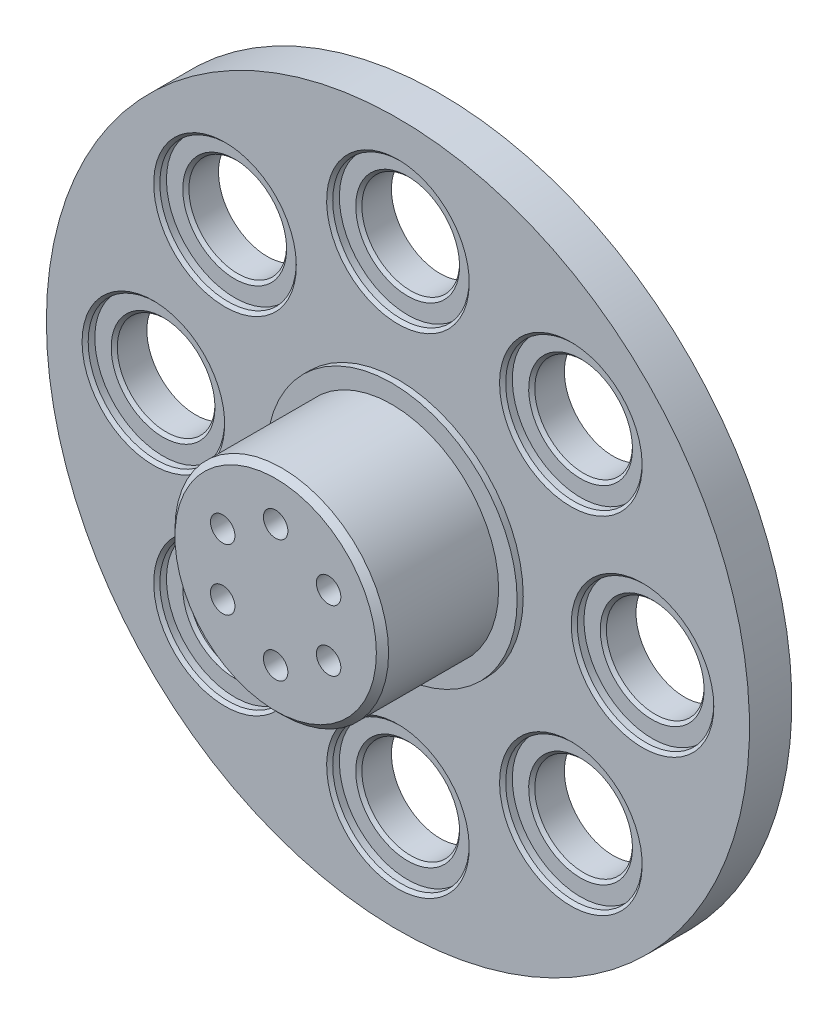
from build123d import *

# Parameters (mm, degrees)
SKETCH1_R                    = 17.475
BOSS_EXTRUDE1_DEPTH          = 19
SKETCH7_R                    = 20.5
BOSS_EXTRUDE3_DEPTH          = 1
SKETCH3_R                    = 57.5
BOSS_EXTRUDE2_DEPTH          = 6.925
SKETCH4_R                    = 11.0375
CUT_EXTRUDE1_DEPTH           = 7
SKETCH5_R                    = 7.5
CUT_EXTRUDE2_DEPTH           = 0.5
SKETCH6_R                    = 2
CUT_EXTRUDE3_DEPTH           = 10
CIRPATTERN1_COUNT            = 6
CHAMFER1_SIZE                = 1
SKETCH8_R                    = 7.99
CUT_EXTRUDE4_DEPTH           = 84.740671122
SKETCH9_R                    = 11.1625
CUT_EXTRUDE5_DEPTH           = 1.5875
CHAMFER2_SIZE                = 0.5
CHAMFER3_SIZE                = 0.5
CIRPATTERN2_COUNT            = 8
CHAMFER2_OF_CIRPATTERN2_SIZE = 0.5
CHAMFER3_OF_CIRPATTERN2_SIZE = 0.5


with BuildPart() as part:
    # Sketch1 → Boss-Extrude1 (new body)
    with BuildSketch(Plane.XY):
        Circle(SKETCH1_R)
    extrude(amount=BOSS_EXTRUDE1_DEPTH)

    # Sketch7 → Boss-Extrude3 (add)
    with BuildSketch(Plane(origin=(0, 0, 0), x_dir=(-1, 0, 0), z_dir=(0, 0, -1))):
        Circle(SKETCH7_R)
    extrude(amount=BOSS_EXTRUDE3_DEPTH)

    # Sketch3 → Boss-Extrude2 (add)
    with BuildSketch(Plane(origin=(0, 0, -1), x_dir=(-1, 0, 0), z_dir=(0, 0, -1))):
        Circle(SKETCH3_R)
    extrude(amount=BOSS_EXTRUDE2_DEPTH)

    # Sketch4 → Cut-Extrude1 (cut)
    with BuildSketch(Plane(origin=(0, 0, -7.925), x_dir=(-1, 0, 0), z_dir=(0, 0, -1))):
        Circle(SKETCH4_R)
    extrude(amount=-CUT_EXTRUDE1_DEPTH, mode=Mode.SUBTRACT)

    # Sketch5 → Cut-Extrude2 (cut)
    with BuildSketch(Plane(origin=(0, 0, -0.925), x_dir=(-1, 0, 0), z_dir=(0, 0, -1))):
        Circle(SKETCH5_R)
    extrude(amount=-CUT_EXTRUDE2_DEPTH, mode=Mode.SUBTRACT)

    # Sketch6 → Cut-Extrude3 (cut)
    with BuildSketch(Plane.XY.offset(19)):
        with Locations((0, 10)):
            Circle(SKETCH6_R)
    cut_extrude3 = extrude(amount=-CUT_EXTRUDE3_DEPTH, mode=Mode.SUBTRACT)

    # CirPattern1: Cut-Extrude3 ×6 about axis
    cirpattern1_axis = Axis((0, 0, 19), (0, 0, 1))
    for i in range(1, CIRPATTERN1_COUNT):
        add(cut_extrude3.rotate(cirpattern1_axis, i * 360 / CIRPATTERN1_COUNT), mode=Mode.SUBTRACT)

    # Chamfer1
    chamfer1_edges = [part.edges().sort_by_distance(p)[0] for p in [
        (11.0375, 0, -7.925),
        (-17.475, 0, 19),
    ]]
    chamfer(chamfer1_edges, length=CHAMFER1_SIZE)

    # Sketch8 → Cut-Extrude4 (cut, through all)
    with BuildSketch(Plane.XY.offset(-1)):
        with Locations((-40, 0)):
            Circle(SKETCH8_R)
    cut_extrude4 = extrude(amount=-CUT_EXTRUDE4_DEPTH, mode=Mode.SUBTRACT)

    # Sketch9 → Cut-Extrude5 (cut)
    with BuildSketch(Plane.XY.offset(-1)):
        with Locations((-40, 0)):
            Circle(SKETCH9_R)
    cut_extrude5 = extrude(amount=-CUT_EXTRUDE5_DEPTH, mode=Mode.SUBTRACT)

    # Chamfer2
    chamfer2_edges = [part.edges().sort_by_distance(p)[0] for p in [
        (-47.99, 0, -2.5875),
    ]]
    chamfer(chamfer2_edges, length=CHAMFER2_SIZE)

    # Chamfer3
    chamfer3_edges = [part.edges().sort_by_distance(p)[0] for p in [
        (-51.1625, 0, -1),
    ]]
    chamfer(chamfer3_edges, length=CHAMFER3_SIZE)

    # CirPattern2: Cut-Extrude4, Cut-Extrude5 ×8 about axis
    cirpattern2_axis = Axis((0, 0, -1), (0, 0, -1))
    add([cut_extrude4.rotate(cirpattern2_axis, i * 360 / CIRPATTERN2_COUNT) for i in range(1, CIRPATTERN2_COUNT)], mode=Mode.SUBTRACT)
    add([cut_extrude5.rotate(cirpattern2_axis, i * 360 / CIRPATTERN2_COUNT) for i in range(1, CIRPATTERN2_COUNT)], mode=Mode.SUBTRACT)

    # Chamfer2 of CirPattern2
    chamfer2_of_cirpattern2_edges = [part.edges().sort_by_distance(p)[0] for p in [
        (-33.934054429, 33.934054429, -2.5875),
        (0, 47.99, -2.5875),
        (33.934054429, 33.934054429, -2.5875),
        (47.99, 0, -2.5875),
        (33.934054429, -33.934054429, -2.5875),
        (0, -47.99, -2.5875),
        (-33.934054429, -33.934054429, -2.5875),
    ]]
    chamfer(chamfer2_of_cirpattern2_edges, length=CHAMFER2_OF_CIRPATTERN2_SIZE)

    # Chamfer3 of CirPattern2
    chamfer3_of_cirpattern2_edges = [part.edges().sort_by_distance(p)[0] for p in [
        (-36.177350692, 36.177350692, -1),
        (0, 51.1625, -1),
        (36.177350692, 36.177350692, -1),
        (51.1625, 0, -1),
        (36.177350692, -36.177350692, -1),
        (0, -51.1625, -1),
        (-36.177350692, -36.177350692, -1),
    ]]
    chamfer(chamfer3_of_cirpattern2_edges, length=CHAMFER3_OF_CIRPATTERN2_SIZE)


solid = part.part
